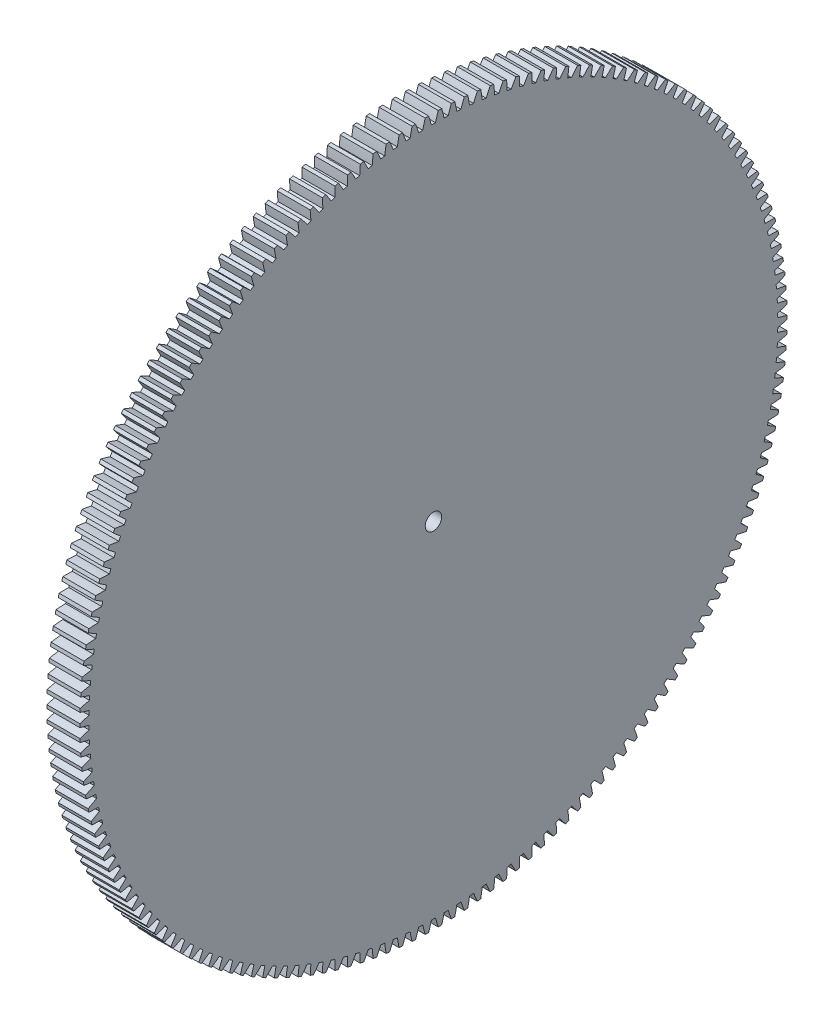
from build123d import *

# Parameters (mm, degrees)
BASPROSKE_W     = 4
BASPROSKE_H     = 43
TOOTHCUT_DEPTH  = 61.942595941
TEETHCUTS_COUNT = 170
TEETHCUTS_ANGLE = 357.882352941
BORSKE_R        = 1
BORE_DEPTH      = 50.0000508


with BuildPart() as part:
    # BasProSke → Base-Revolve (revolve)
    with BuildSketch(Plane(origin=(0, 0, 0), x_dir=(1, 0, 0), z_dir=(0, 1, 0))):
        with Locations((2, 21.5)):
            Rectangle(BASPROSKE_W, BASPROSKE_H)
    revolve(axis=Axis((-10, 0, 0), (1, 0, 0)))

    # TooCutSke → ToothCut (cut, through all)
    with BuildSketch(Plane(origin=(0, 0, 0), x_dir=(0, 0, -1), z_dir=(1, 0, 0))):
        with BuildLine():
            ThreePointArc((0.25103426, 41.873247519), (0, 41.874), (-0.25103426, 41.873247519))
            ThreePointArc((-0.25103426, 41.873247519), (-0.411713116, 42.450292445), (-0.592621351, 43.021318496))
            ThreePointArc((-0.592621351, 43.021318496), (0, 43.0254), (0.592621351, 43.021318496))
            ThreePointArc((0.592621351, 43.021318496), (0.411713116, 42.450292445), (0.25103426, 41.873247519))
        make_face()
    toothcut = extrude(amount=TOOTHCUT_DEPTH, mode=Mode.SUBTRACT)

    # TeethCuts: ToothCut ×170 about axis
    teethcuts_axis = Axis((-10, 0, 0), (1, 0, 0))
    for i in range(1, TEETHCUTS_COUNT):
        add(toothcut.rotate(teethcuts_axis, i * TEETHCUTS_ANGLE / (TEETHCUTS_COUNT - 1)), mode=Mode.SUBTRACT)

    # BorSke → Bore (cut, symmetric)
    with BuildSketch(Plane(origin=(0, 0, 0), x_dir=(0, 0, -1), z_dir=(1, 0, 0))):
        Circle(BORSKE_R)
    extrude(amount=BORE_DEPTH, both=True, mode=Mode.SUBTRACT)


solid = part.part
